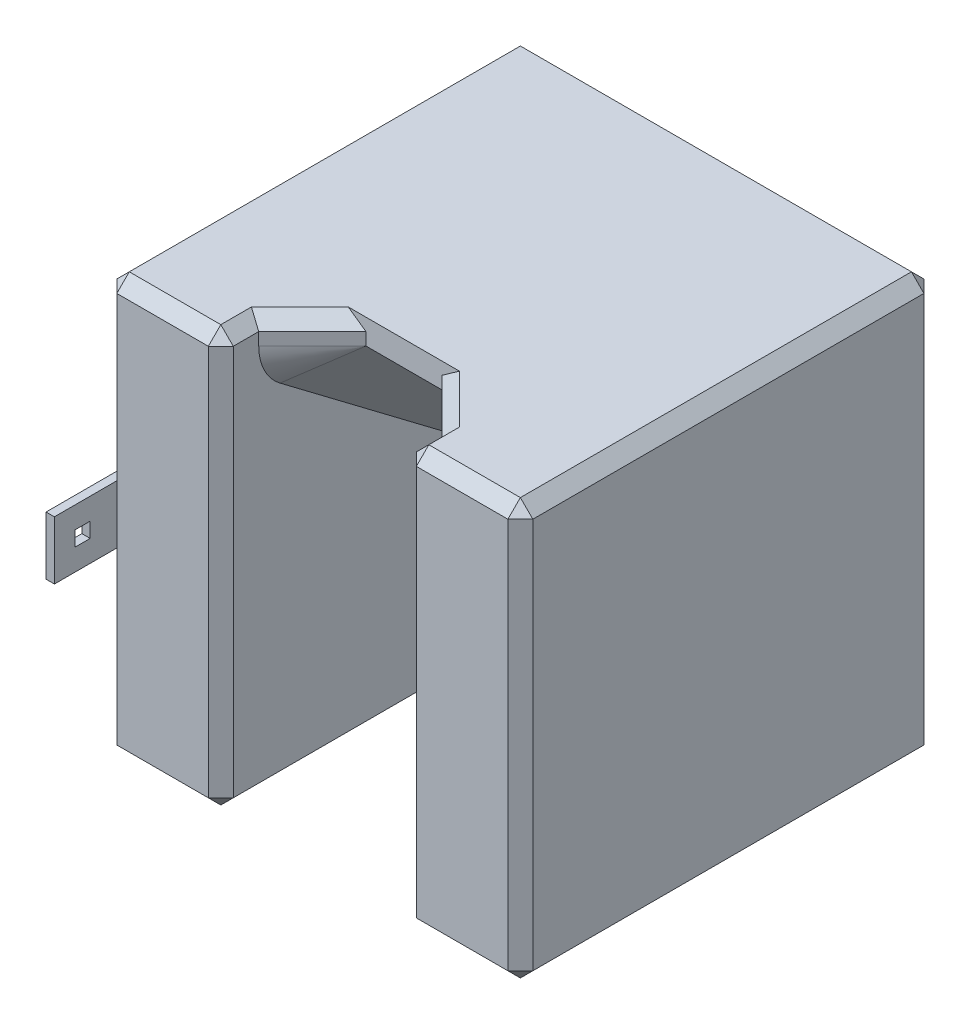
from build123d import *

# Parameters (mm, degrees)
SKETCH1_W                = 50
SKETCH1_H                = 50
BOSS_EXTRUDE1_DEPTH      = 50
CUT_SWEEP3_START         = 47
CUT_SWEEP3_DEPTH         = 3
CUT_SWEEP3_2_ANGLE       = 52.934263
SKETCH12_W               = 22
SKETCH12_H               = 36
CUT_EXTRUDE6_DEPTH       = 11
SKETCH13_W               = 22
SKETCH13_H               = 20.943650814
CUT_EXTRUDE7_DEPTH       = 20
SKETCH14_W               = 22
SKETCH14_H               = 7.504472325
CUT_EXTRUDE8_DEPTH       = 12
CHAMFER1_SIZE            = 1.5
BOSS_EXTRUDE2_DEPTH      = 7
BOSS_EXTRUDE2_DEPTH_BACK = 10
SKETCH15_W               = 1
SKETCH15_H               = 7
SKETCH16_W               = 1.8
SKETCH16_H               = 1.8
CUT_EXTRUDE9_DEPTH       = 7


with BuildPart() as part:
    # Sketch1 → Boss-Extrude1 (new body)
    with BuildSketch(Plane.XY):
        with Locations((25, 25)):
            Rectangle(SKETCH1_W, SKETCH1_H)
    extrude(amount=BOSS_EXTRUDE1_DEPTH)

    # Cut-Sweep3: read off the stored shape, not the designer's step
    # Cut-Sweep3 outline → Cut-Sweep3 (cut)
    with BuildSketch(Plane(origin=(0, 0, 0), x_dir=(1, 0, 0), z_dir=(0, 1, 0)).offset(CUT_SWEEP3_START)):
        Polygon((20.443650814, -39), (14, -45.443650814), (14, -50), (36, -50), (36, -45.443650814), (29.556349186, -39), align=None)
    extrude(amount=CUT_SWEEP3_DEPTH, mode=Mode.SUBTRACT)

    # Cut-Sweep3 2 outline → Cut-Sweep3 2 (revolve, cut)
    with BuildSketch(Plane(origin=(0, 47, 39), x_dir=(0, 0, 1), z_dir=(0, 1, 0))):
        Polygon((6.443650814, 14), (15.556349186, 14), (18.250266522, 16.693917336), (18.250266522, 33.306082664), (15.556349091, 36.000000095), (6.443650814, 36), (0, 29.556349186), (0, 20.443650814), align=None)
    revolve(axis=Axis((0, 47, 39), (1, 0, 0)), revolution_arc=CUT_SWEEP3_2_ANGLE, mode=Mode.SUBTRACT)

    # Cut-Sweep4: sweep along a path in Sketch9
    with BuildLine(Plane(origin=(25, 0, 0), x_dir=(0, 0, -1), z_dir=(1, 0, 0))) as cut_sweep4_path:
        Line((-13.5, 0), (-13.5, 3))
        ThreePointArc((-13.5, 3), (-15.805815997, 12.805055658), (-22.239919677, 20.554779117))
        Line((-22.239919677, 20.554779117), (-45.630040161, 38.222610442))
    # Sketch5<2> → Cut-Sweep4 (sweep, cut)
    with BuildSketch(Plane(origin=(25, 38.222610442, 45.630040161), x_dir=(-1, 0, 0), z_dir=(0, -0.6027309237648077, -0.7979445052994735))):
        Polygon((4.556349186, 11), (-4.556349186, 11), (-11, 4.556349186), (-11, -4.556349186), (-4.556349186, -11), (4.556349186, -11), (11, -4.556349186), (11, 4.556349186), align=None)
    sweep(path=cut_sweep4_path.line, mode=Mode.SUBTRACT)

    # Sketch12 → Cut-Extrude6 (cut)
    with BuildSketch(Plane.XY.offset(50)):
        with Locations((25, 18)):
            Rectangle(SKETCH12_W, SKETCH12_H)
    extrude(amount=-CUT_EXTRUDE6_DEPTH, mode=Mode.SUBTRACT)

    # Sketch13 → Cut-Extrude7 (cut)
    with BuildSketch(Plane.XZ):
        with Locations((25, 28.528174593)):
            Rectangle(SKETCH13_W, SKETCH13_H)
    extrude(amount=-CUT_EXTRUDE7_DEPTH, mode=Mode.SUBTRACT)

    # Sketch14 → Cut-Extrude8 (cut)
    with BuildSketch(Plane.XY.offset(39)):
        with Locations((25, 23.752236163)):
            Rectangle(SKETCH14_W, SKETCH14_H)
    extrude(amount=-CUT_EXTRUDE8_DEPTH, mode=Mode.SUBTRACT)

    # Chamfer1
    chamfer1_edges = [part.edges().sort_by_distance(p)[0] for p in [
        (50, 25, 50),
        (43, 0, 50),
        (43, 50, 50),
        (7, 50, 50),
        (14, 25, 50),
        (36, 18, 50),
        (14, 50, 47.721825407),
        (36, 50, 47.721825407),
        (32.778174593, 50, 42.221825407),
        (17.221825407, 50, 42.221825407),
        (0, 25, 50),
        (25, 50, 0),
        (50, 25, 0),
        (25, 0, 0),
        (0, 25, 0),
        (17.221825407, 0, 5.721825407),
        (32.778174593, 0, 5.721825407),
        (36, 0, 29.471825407),
        (14, 0, 29.471825407),
        (7, 0, 50),
        (0, 50, 25),
        (50, 50, 25),
        (50, 0, 25),
        (0, 0, 25),
    ]]
    chamfer(chamfer1_edges, length=CHAMFER1_SIZE)

    # Sketch15 → Boss-Extrude2 (add, two sides: drawn at the far end of the back side and taken through both)
    with BuildSketch(Plane.XY.offset(50).offset(-BOSS_EXTRUDE2_DEPTH_BACK)):
        with Locations((0.5, 25)):
            Rectangle(SKETCH15_W, SKETCH15_H)
    extrude(amount=BOSS_EXTRUDE2_DEPTH + BOSS_EXTRUDE2_DEPTH_BACK)

    # Sketch16 → Cut-Extrude9 (cut)
    with BuildSketch(Plane(origin=(1, 0, 0), x_dir=(0, 0, -1), z_dir=(1, 0, 0))):
        with Locations((-53.6, 25)):
            Rectangle(SKETCH16_W, SKETCH16_H)
    extrude(amount=-CUT_EXTRUDE9_DEPTH, mode=Mode.SUBTRACT)


solid = part.part
